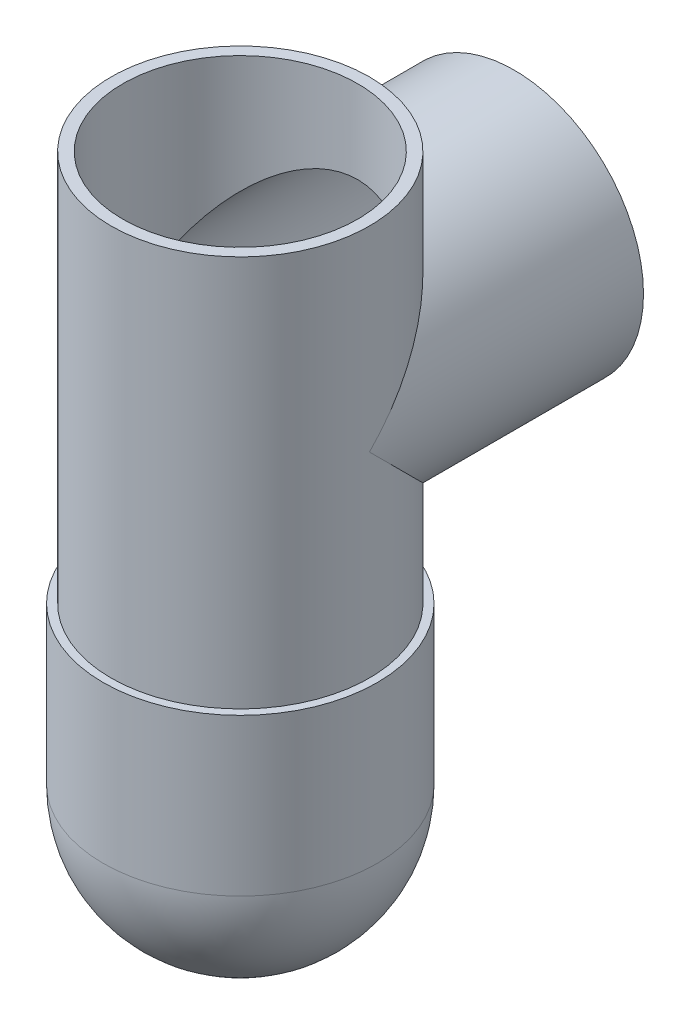
from build123d import *

# Parameters (mm, degrees)
SKETCH1_R                = 15
BOSS_EXTRUDE1_DEPTH      = 70
SKETCH7_R                = 17.5
BOSS_EXTRUDE2_DEPTH      = 20
SKETCH8_R                = 16.5
SKETCH8_R_2              = 15
BOSS_EXTRUDE4_DEPTH      = 70
SKETCH10_R               = 15
CUT_EXTRUDE2_DEPTH       = 70
SKETCH24_R               = 15
CUT_EXTRUDE4_DEPTH       = 22
BOSS_EXTRUDE5_DEPTH      = 15
BOSS_EXTRUDE5_DEPTH_BACK = 20
SKETCH30_R               = 16.5
SKETCH31_R               = 15
CUT_EXTRUDE5_DEPTH       = 37
SKETCH32_R               = 15
CUT_EXTRUDE6_DEPTH       = 55


# Read off the part's stored shape, not the designer's step: Revolve1
with BuildPart() as part:
    # Sketch1 → Boss-Extrude1 (new body)
    with BuildSketch(Plane(origin=(0, 0, 0), x_dir=(1, 0, 0), z_dir=(0, 1, 0))):
        with Locations(Location((0, 0, 0), (0, 0, 270))):
            Circle(SKETCH1_R)
    extrude(amount=-BOSS_EXTRUDE1_DEPTH)

    # Sketch7 → Boss-Extrude2 (add)
    with BuildSketch(Plane.XZ.offset(70)):
        with Locations(Location((0, 0, 0), (0, 0, 270))):
            Circle(SKETCH7_R)
    extrude(amount=-BOSS_EXTRUDE2_DEPTH)

    # Sketch8 → Boss-Extrude4 (add)
    with BuildSketch(Plane(origin=(0, 0, 0), x_dir=(1, 0, 0), z_dir=(0, 1, 0))):
        with Locations(Location((0, 0, 0), (0, 0, 270))):
            Circle(SKETCH8_R)
        Circle(SKETCH8_R_2, mode=Mode.SUBTRACT)
    extrude(amount=-BOSS_EXTRUDE4_DEPTH)

    # Sketch10 → Cut-Extrude2 (cut)
    with BuildSketch(Plane(origin=(0, 0, 0), x_dir=(1, 0, 0), z_dir=(0, 1, 0))):
        with Locations(Location((0, 0, 0), (0, 0, 270))):
            Circle(SKETCH10_R)
    extrude(amount=-CUT_EXTRUDE2_DEPTH, mode=Mode.SUBTRACT)

    # Revolve1 outline → Revolve1 (revolve)
    with BuildSketch(Plane.XY):
        with BuildLine():
            Line((17.5, -69.999999983), (0, -69.999999992))
            Line((0, -69.999999992), (0, -87.5))
            ThreePointArc((0, -87.5), (12.374368677, -82.374368665), (17.5, -69.999999983))
        make_face()
    revolve(axis=Axis((0, 0, 0), (0, 1, 0)))

    # Sketch24 → Cut-Extrude4 (cut)
    with BuildSketch(Plane.XY):
        with Locations((0, -25)):
            Circle(SKETCH24_R)
    extrude(amount=-CUT_EXTRUDE4_DEPTH, mode=Mode.SUBTRACT)

    # Sketch28 → Cut-Revolve1 (revolve, cut)
    with BuildSketch(Plane.XY):
        with BuildLine():
            Line((15, -70), (-15, -70))
            ThreePointArc((-15, -70), (0, -85), (15, -70))
        make_face()
    revolve(axis=Axis((-15, -70, 0), (1, 0, 0)), mode=Mode.SUBTRACT)

    # Sketch30 → Boss-Extrude5 (add, two sides: drawn at the far end of the back side and taken through both)
    with BuildSketch(Plane.XY.offset(-15).offset(-BOSS_EXTRUDE5_DEPTH_BACK)):
        with Locations((0, -25)):
            Circle(SKETCH30_R)
    extrude(amount=BOSS_EXTRUDE5_DEPTH + BOSS_EXTRUDE5_DEPTH_BACK)

    # Sketch31 → Cut-Extrude5 (cut)
    with BuildSketch(Plane(origin=(0, 0, -35), x_dir=(-1, 0, 0), z_dir=(0, 0, -1))):
        with Locations((0, -25.611375347)):
            Circle(SKETCH31_R)
    extrude(amount=-CUT_EXTRUDE5_DEPTH, mode=Mode.SUBTRACT)

    # Sketch32 → Cut-Extrude6 (cut)
    with BuildSketch(Plane(origin=(0, 0, 0), x_dir=(1, 0, 0), z_dir=(0, 1, 0))):
        with Locations(Location((0, 0, 0), (0, 0, 270))):
            Circle(SKETCH32_R)
    extrude(amount=-CUT_EXTRUDE6_DEPTH, mode=Mode.SUBTRACT)


solid = part.part
